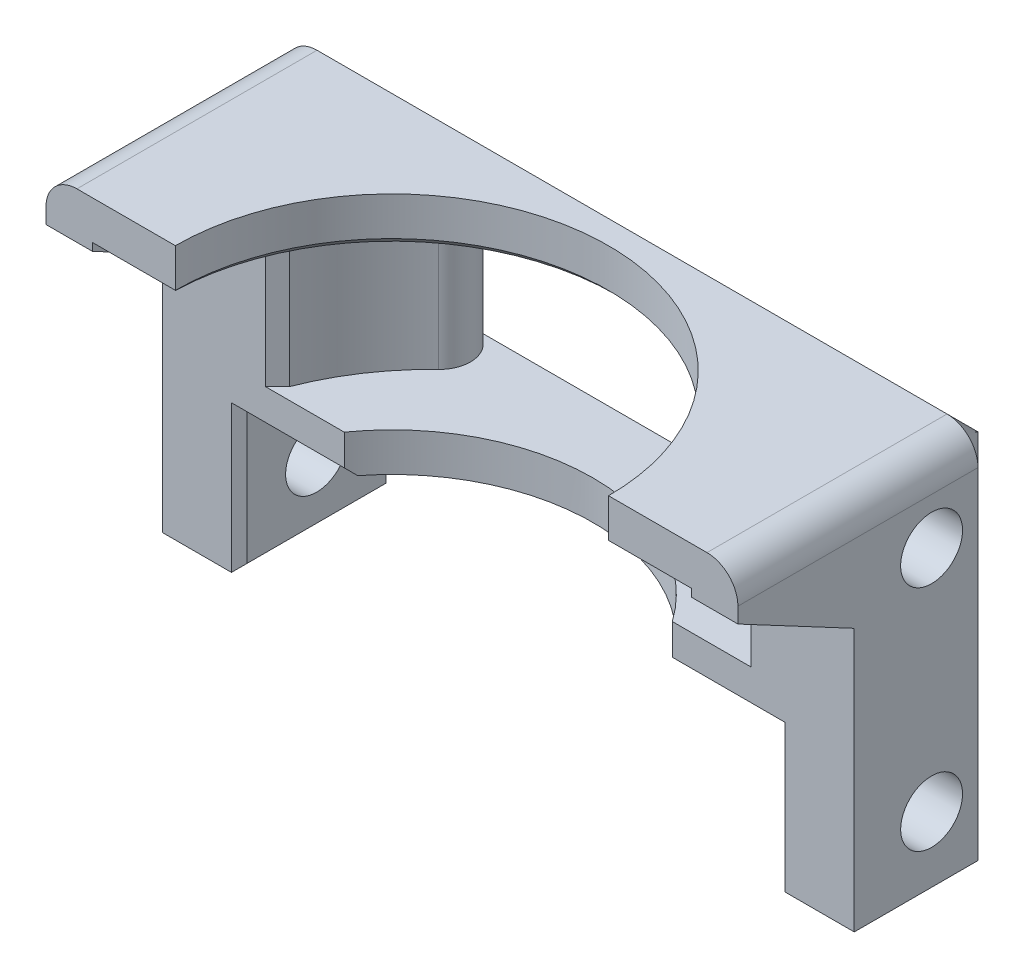
from build123d import *

# Parameters (mm, degrees)
EXTRUDE_1_DEPTH     = 10
SKETCH_2_W          = 16
SKETCH_2_H          = 9.5
EXTRUDE_2_DEPTH     = 17.52
CUT_EXTRUDE_1_DEPTH = 3
CUT_EXTRUDE_2_DEPTH = 2.5
EXTRUDE_3_DEPTH     = 3
EXTRUDE_4_DEPTH     = 3
FILLET_1_R          = 2
CHAMFER_1_SIZE      = 2
CUT_EXTRUDE_3_DEPTH = 6
CUT_EXTRUDE_4_REACH = 55.7
CHAMFER_2_SIZE      = 0.5
FILLET_2_R          = 2


# Some blends are built 0.0001 mm under size
with BuildPart() as part:
    # 草图1 → 凸台-拉伸1 (new body)
    with BuildSketch(Plane.XY):
        Polygon((0, 0), (4.97, 0), (4.97, 9), (39.75, 9), (39.75, 0), (44.73, 0), (44.73, 24), (0, 24), align=None)
    extrude(amount=EXTRUDE_1_DEPTH)

    # 草图2 → 切除-旋转2 (revolve, cut)
    with BuildSketch(Plane(origin=(0, 0, 15), x_dir=(-1, 0, 0), z_dir=(0, 0, -1))):
        with Locations((-14.365, 16.25)):
            Rectangle(SKETCH_2_W, SKETCH_2_H)
    revolve(axis=Axis((22.365, 28.168186047, 15), (0, -1, 0)), mode=Mode.SUBTRACT)

    # 草图4 → 凸台-拉伸2 (add)
    with BuildSketch(Plane(origin=(0, 0, 0), x_dir=(-1, 0, 0), z_dir=(0, 0, -1))):
        Polygon((-44.73, 24), (0, 24), (0, 21), (-7.166315846, 21), (-37.563684154, 21), (-44.73, 21), align=None)
    extrude(amount=-EXTRUDE_2_DEPTH)

    # 草图5 → 切除-拉伸1 (cut)
    with BuildSketch(Plane(origin=(0, 24, 0), x_dir=(1, 0, 0), z_dir=(0, 1, 0))):
        with BuildLine():
            Line((8.365, -17.52), (36.365, -17.52))
            ThreePointArc((36.365, -17.52), (22.365, -3.52), (8.365, -17.52))
        make_face()
    extrude(amount=-CUT_EXTRUDE_1_DEPTH, mode=Mode.SUBTRACT)

    # 草图6 → 切除-拉伸2 (cut)
    with BuildSketch(Plane(origin=(0, 11.5, 0), x_dir=(1, 0, 0), z_dir=(0, 1, 0))):
        with BuildLine():
            ThreePointArc((32.969225573, -10), (22.365, -4.52), (11.760774427, -10))
            Line((11.760774427, -10), (32.969225573, -10))
        make_face()
    extrude(amount=-CUT_EXTRUDE_2_DEPTH, mode=Mode.SUBTRACT)

    # 草图7 → 凸台-拉伸3 (add)
    with BuildSketch(Plane.ZY):
        Polygon((10, 17), (10, 21), (17.52, 21), align=None)
    extrude(amount=-EXTRUDE_3_DEPTH)

    # 草图8 → 凸台-拉伸4 (add)
    with BuildSketch(Plane(origin=(44.73, 0, 0), x_dir=(0, 0, -1), z_dir=(1, 0, 0))):
        Polygon((-17.52, 21), (-10, 17), (-10, 21), align=None)
    extrude(amount=-EXTRUDE_4_DEPTH)

    # 圆角1
    fillet_1_edges = [part.edges().sort_by_distance(p)[0] for p in [
        (0, 24, 8.76),
        (44.73, 24, 8.76),
    ]]
    fillet(fillet_1_edges, radius=FILLET_1_R)

    # 倒角1
    chamfer_1_edges = [part.edges().sort_by_distance(p)[0] for p in [
        (22.365, 24, 0),
        (0, 11, 0),
        (0.585786438, 23.414213562, 0),
        (44.144213562, 23.414213562, 0),
        (44.73, 11, 0),
    ]]
    chamfer(chamfer_1_edges, length=CHAMFER_1_SIZE - 0.0001)  # a hair under: the kernel refuses the full size

    # 草图9 → 切除-拉伸3 (cut)
    with BuildSketch(Plane(origin=(44.73, 0, 0), x_dir=(0, 0, -1), z_dir=(1, 0, 0))):
        with BuildLine():
            ThreePointArc((-6.414213562, 17.585786438), (-5, 17), (-3.585786438, 17.585786438))
            Line((-3.585786438, 17.585786438), (-5, 19))
            Line((-5, 19), (-6.414213562, 17.585786438))
        make_face()
        with BuildLine():
            Line((-5, 19), (-3.585786438, 17.585786438))
            ThreePointArc((-3.585786438, 17.585786438), (-3.152240935, 18.234633135), (-3, 19))
            ThreePointArc((-3, 19), (-3.152240935, 19.765366865), (-3.585786438, 20.414213562))
            Line((-3.585786438, 20.414213562), (-5, 19))
        make_face()
        with BuildLine():
            ThreePointArc((-6.414213562, 20.414213562), (-7, 19), (-6.414213562, 17.585786438))
            Line((-6.414213562, 17.585786438), (-5, 19))
            Line((-5, 19), (-6.414213562, 20.414213562))
        make_face()
        with BuildLine():
            Line((-6.414213562, 20.414213562), (-5, 19))
            Line((-5, 19), (-3.585786438, 20.414213562))
            ThreePointArc((-3.585786438, 20.414213562), (-5, 21), (-6.414213562, 20.414213562))
        make_face()
    cut_extrude_3 = extrude(amount=-CUT_EXTRUDE_3_DEPTH, mode=Mode.SUBTRACT)

    # 镜向1: 切除-拉伸3 across plane
    add(cut_extrude_3.mirror(Plane(origin=(22.365, 0, 0), x_dir=(0, 0, 1), z_dir=(1, 0, 0))), mode=Mode.SUBTRACT)

    # 切除-拉伸4: up to this face of the body (flat: up to its plane)
    cut_extrude_4_end = Plane(part.part.faces().sort_by_distance((44.73, 11.584828714, 6.907402267))[0])
    # 草图10 → 切除-拉伸4 (cut, up to the picked face)
    with BuildSketch(Plane.ZY, mode=Mode.PRIVATE) as cut_extrude_4_sk1:
        with BuildLine():
            ThreePointArc((3.474277506, 2.944620168), (5, 2.237744629), (6.525722494, 2.944620168))
            Line((6.525722494, 2.944620168), (5, 4.237744629))
            Line((5, 4.237744629), (3.474277506, 2.944620168))
        make_face()
    cut_extrude_4_tool1 = split(extrude(cut_extrude_4_sk1.sketch, amount=-CUT_EXTRUDE_4_REACH, mode=Mode.PRIVATE), bisect_by=cut_extrude_4_end, keep=Keep.BOTH, mode=Mode.PRIVATE)
    # 草图10 → 切除-拉伸4 (cut, up to the picked face)
    with BuildSketch(Plane.ZY, mode=Mode.PRIVATE) as cut_extrude_4_sk2:
        with BuildLine():
            Line((5, 4.237744629), (6.525722494, 2.944620168))
            ThreePointArc((6.525722494, 2.944620168), (6.877690734, 3.549066543), (7, 4.237744629))
            ThreePointArc((7, 4.237744629), (6.877690734, 4.926422715), (6.525722494, 5.53086909))
            Line((6.525722494, 5.53086909), (5, 4.237744629))
        make_face()
    cut_extrude_4_tool2 = split(extrude(cut_extrude_4_sk2.sketch, amount=-CUT_EXTRUDE_4_REACH, mode=Mode.PRIVATE), bisect_by=cut_extrude_4_end, keep=Keep.BOTH, mode=Mode.PRIVATE)
    # 草图10 → 切除-拉伸4 (cut, up to the picked face)
    with BuildSketch(Plane.ZY, mode=Mode.PRIVATE) as cut_extrude_4_sk3:
        with BuildLine():
            ThreePointArc((3.474277506, 5.53086909), (3, 4.237744629), (3.474277506, 2.944620168))
            Line((3.474277506, 2.944620168), (5, 4.237744629))
            Line((5, 4.237744629), (3.474277506, 5.53086909))
        make_face()
    cut_extrude_4_tool3 = split(extrude(cut_extrude_4_sk3.sketch, amount=-CUT_EXTRUDE_4_REACH, mode=Mode.PRIVATE), bisect_by=cut_extrude_4_end, keep=Keep.BOTH, mode=Mode.PRIVATE)
    # 草图10 → 切除-拉伸4 (cut, up to the picked face)
    with BuildSketch(Plane.ZY, mode=Mode.PRIVATE) as cut_extrude_4_sk4:
        with BuildLine():
            Line((5, 4.237744629), (6.525722494, 5.53086909))
            ThreePointArc((6.525722494, 5.53086909), (5, 6.237744629), (3.474277506, 5.53086909))
            Line((3.474277506, 5.53086909), (5, 4.237744629))
        make_face()
    cut_extrude_4_tool4 = split(extrude(cut_extrude_4_sk4.sketch, amount=-CUT_EXTRUDE_4_REACH, mode=Mode.PRIVATE), bisect_by=cut_extrude_4_end, keep=Keep.BOTH, mode=Mode.PRIVATE)
    # 草图10 → 切除-拉伸4 (cut, up to the picked face)
    with BuildSketch(Plane.ZY, mode=Mode.PRIVATE) as cut_extrude_4_sk5:
        with BuildLine():
            ThreePointArc((3.474277506, 2.944620168), (5, 2.237744629), (6.525722494, 2.944620168))
            Line((6.525722494, 2.944620168), (5, 4.237744629))
            Line((5, 4.237744629), (3.474277506, 2.944620168))
        make_face()
    cut_extrude_4_tool5 = split(extrude(cut_extrude_4_sk5.sketch, amount=-CUT_EXTRUDE_4_REACH, mode=Mode.PRIVATE), bisect_by=cut_extrude_4_end, keep=Keep.BOTH, mode=Mode.PRIVATE)
    # 草图10 → 切除-拉伸4 (cut, up to the picked face)
    with BuildSketch(Plane.ZY, mode=Mode.PRIVATE) as cut_extrude_4_sk6:
        with BuildLine():
            Line((5, 4.237744629), (6.525722494, 2.944620168))
            ThreePointArc((6.525722494, 2.944620168), (6.877690734, 3.549066543), (7, 4.237744629))
            ThreePointArc((7, 4.237744629), (6.877690734, 4.926422715), (6.525722494, 5.53086909))
            Line((6.525722494, 5.53086909), (5, 4.237744629))
        make_face()
    cut_extrude_4_tool6 = split(extrude(cut_extrude_4_sk6.sketch, amount=-CUT_EXTRUDE_4_REACH, mode=Mode.PRIVATE), bisect_by=cut_extrude_4_end, keep=Keep.BOTH, mode=Mode.PRIVATE)
    # 草图10 → 切除-拉伸4 (cut, up to the picked face)
    with BuildSketch(Plane.ZY, mode=Mode.PRIVATE) as cut_extrude_4_sk7:
        with BuildLine():
            ThreePointArc((3.474277506, 5.53086909), (3, 4.237744629), (3.474277506, 2.944620168))
            Line((3.474277506, 2.944620168), (5, 4.237744629))
            Line((5, 4.237744629), (3.474277506, 5.53086909))
        make_face()
    cut_extrude_4_tool7 = split(extrude(cut_extrude_4_sk7.sketch, amount=-CUT_EXTRUDE_4_REACH, mode=Mode.PRIVATE), bisect_by=cut_extrude_4_end, keep=Keep.BOTH, mode=Mode.PRIVATE)
    # 草图10 → 切除-拉伸4 (cut, up to the picked face)
    with BuildSketch(Plane.ZY, mode=Mode.PRIVATE) as cut_extrude_4_sk8:
        with BuildLine():
            Line((5, 4.237744629), (6.525722494, 5.53086909))
            ThreePointArc((6.525722494, 5.53086909), (5, 6.237744629), (3.474277506, 5.53086909))
            Line((3.474277506, 5.53086909), (5, 4.237744629))
        make_face()
    cut_extrude_4_tool8 = split(extrude(cut_extrude_4_sk8.sketch, amount=-CUT_EXTRUDE_4_REACH, mode=Mode.PRIVATE), bisect_by=cut_extrude_4_end, keep=Keep.BOTH, mode=Mode.PRIVATE)
    # 草图10 → 切除-拉伸4 (cut, up to the picked face)
    with BuildSketch(Plane.ZY, mode=Mode.PRIVATE) as cut_extrude_4_sk9:
        with BuildLine():
            ThreePointArc((3.474277506, 2.944620168), (5, 2.237744629), (6.525722494, 2.944620168))
            Line((6.525722494, 2.944620168), (5, 4.237744629))
            Line((5, 4.237744629), (3.474277506, 2.944620168))
        make_face()
    cut_extrude_4_tool9 = split(extrude(cut_extrude_4_sk9.sketch, amount=-CUT_EXTRUDE_4_REACH, mode=Mode.PRIVATE), bisect_by=cut_extrude_4_end, keep=Keep.BOTH, mode=Mode.PRIVATE)
    # 草图10 → 切除-拉伸4 (cut, up to the picked face)
    with BuildSketch(Plane.ZY, mode=Mode.PRIVATE) as cut_extrude_4_sk10:
        with BuildLine():
            Line((5, 4.237744629), (6.525722494, 2.944620168))
            ThreePointArc((6.525722494, 2.944620168), (6.877690734, 3.549066543), (7, 4.237744629))
            ThreePointArc((7, 4.237744629), (6.877690734, 4.926422715), (6.525722494, 5.53086909))
            Line((6.525722494, 5.53086909), (5, 4.237744629))
        make_face()
    cut_extrude_4_tool10 = split(extrude(cut_extrude_4_sk10.sketch, amount=-CUT_EXTRUDE_4_REACH, mode=Mode.PRIVATE), bisect_by=cut_extrude_4_end, keep=Keep.BOTH, mode=Mode.PRIVATE)
    # 草图10 → 切除-拉伸4 (cut, up to the picked face)
    with BuildSketch(Plane.ZY, mode=Mode.PRIVATE) as cut_extrude_4_sk11:
        with BuildLine():
            ThreePointArc((3.474277506, 5.53086909), (3, 4.237744629), (3.474277506, 2.944620168))
            Line((3.474277506, 2.944620168), (5, 4.237744629))
            Line((5, 4.237744629), (3.474277506, 5.53086909))
        make_face()
    cut_extrude_4_tool11 = split(extrude(cut_extrude_4_sk11.sketch, amount=-CUT_EXTRUDE_4_REACH, mode=Mode.PRIVATE), bisect_by=cut_extrude_4_end, keep=Keep.BOTH, mode=Mode.PRIVATE)
    # 草图10 → 切除-拉伸4 (cut, up to the picked face)
    with BuildSketch(Plane.ZY, mode=Mode.PRIVATE) as cut_extrude_4_sk12:
        with BuildLine():
            Line((5, 4.237744629), (6.525722494, 5.53086909))
            ThreePointArc((6.525722494, 5.53086909), (5, 6.237744629), (3.474277506, 5.53086909))
            Line((3.474277506, 5.53086909), (5, 4.237744629))
        make_face()
    cut_extrude_4_tool12 = split(extrude(cut_extrude_4_sk12.sketch, amount=-CUT_EXTRUDE_4_REACH, mode=Mode.PRIVATE), bisect_by=cut_extrude_4_end, keep=Keep.BOTH, mode=Mode.PRIVATE)
    # 草图10 → 切除-拉伸4 (cut, up to the picked face)
    with BuildSketch(Plane.ZY, mode=Mode.PRIVATE) as cut_extrude_4_sk13:
        with BuildLine():
            ThreePointArc((3.474277506, 2.944620168), (5, 2.237744629), (6.525722494, 2.944620168))
            Line((6.525722494, 2.944620168), (5, 4.237744629))
            Line((5, 4.237744629), (3.474277506, 2.944620168))
        make_face()
    cut_extrude_4_tool13 = split(extrude(cut_extrude_4_sk13.sketch, amount=-CUT_EXTRUDE_4_REACH, mode=Mode.PRIVATE), bisect_by=cut_extrude_4_end, keep=Keep.BOTH, mode=Mode.PRIVATE)
    # 草图10 → 切除-拉伸4 (cut, up to the picked face)
    with BuildSketch(Plane.ZY, mode=Mode.PRIVATE) as cut_extrude_4_sk14:
        with BuildLine():
            Line((5, 4.237744629), (6.525722494, 2.944620168))
            ThreePointArc((6.525722494, 2.944620168), (6.877690734, 3.549066543), (7, 4.237744629))
            ThreePointArc((7, 4.237744629), (6.877690734, 4.926422715), (6.525722494, 5.53086909))
            Line((6.525722494, 5.53086909), (5, 4.237744629))
        make_face()
    cut_extrude_4_tool14 = split(extrude(cut_extrude_4_sk14.sketch, amount=-CUT_EXTRUDE_4_REACH, mode=Mode.PRIVATE), bisect_by=cut_extrude_4_end, keep=Keep.BOTH, mode=Mode.PRIVATE)
    # 草图10 → 切除-拉伸4 (cut, up to the picked face)
    with BuildSketch(Plane.ZY, mode=Mode.PRIVATE) as cut_extrude_4_sk15:
        with BuildLine():
            ThreePointArc((3.474277506, 5.53086909), (3, 4.237744629), (3.474277506, 2.944620168))
            Line((3.474277506, 2.944620168), (5, 4.237744629))
            Line((5, 4.237744629), (3.474277506, 5.53086909))
        make_face()
    cut_extrude_4_tool15 = split(extrude(cut_extrude_4_sk15.sketch, amount=-CUT_EXTRUDE_4_REACH, mode=Mode.PRIVATE), bisect_by=cut_extrude_4_end, keep=Keep.BOTH, mode=Mode.PRIVATE)
    # 草图10 → 切除-拉伸4 (cut, up to the picked face)
    with BuildSketch(Plane.ZY, mode=Mode.PRIVATE) as cut_extrude_4_sk16:
        with BuildLine():
            Line((5, 4.237744629), (6.525722494, 5.53086909))
            ThreePointArc((6.525722494, 5.53086909), (5, 6.237744629), (3.474277506, 5.53086909))
            Line((3.474277506, 5.53086909), (5, 4.237744629))
        make_face()
    cut_extrude_4_tool16 = split(extrude(cut_extrude_4_sk16.sketch, amount=-CUT_EXTRUDE_4_REACH, mode=Mode.PRIVATE), bisect_by=cut_extrude_4_end, keep=Keep.BOTH, mode=Mode.PRIVATE)
    add(cut_extrude_4_tool1.solids().sort_by(Axis((0, 3.065546, 5), (1, 0, 0)))[0], mode=Mode.SUBTRACT)
    add(cut_extrude_4_tool2.solids().sort_by(Axis((0, 4.237745, 6.226171), (1, 0, 0)))[0], mode=Mode.SUBTRACT)
    add(cut_extrude_4_tool3.solids().sort_by(Axis((0, 4.237745, 3.773829), (1, 0, 0)))[0], mode=Mode.SUBTRACT)
    add(cut_extrude_4_tool4.solids().sort_by(Axis((0, 5.409943, 5), (1, 0, 0)))[0], mode=Mode.SUBTRACT)
    add(cut_extrude_4_tool5.solids().sort_by(Axis((0, 3.065546, 5), (1, 0, 0)))[0], mode=Mode.SUBTRACT)
    add(cut_extrude_4_tool6.solids().sort_by(Axis((0, 4.237745, 6.226171), (1, 0, 0)))[0], mode=Mode.SUBTRACT)
    add(cut_extrude_4_tool7.solids().sort_by(Axis((0, 4.237745, 3.773829), (1, 0, 0)))[0], mode=Mode.SUBTRACT)
    add(cut_extrude_4_tool8.solids().sort_by(Axis((0, 5.409943, 5), (1, 0, 0)))[0], mode=Mode.SUBTRACT)
    add(cut_extrude_4_tool9.solids().sort_by(Axis((0, 3.065546, 5), (1, 0, 0)))[0], mode=Mode.SUBTRACT)
    add(cut_extrude_4_tool10.solids().sort_by(Axis((0, 4.237745, 6.226171), (1, 0, 0)))[0], mode=Mode.SUBTRACT)
    add(cut_extrude_4_tool11.solids().sort_by(Axis((0, 4.237745, 3.773829), (1, 0, 0)))[0], mode=Mode.SUBTRACT)
    add(cut_extrude_4_tool12.solids().sort_by(Axis((0, 5.409943, 5), (1, 0, 0)))[0], mode=Mode.SUBTRACT)
    add(cut_extrude_4_tool13.solids().sort_by(Axis((0, 3.065546, 5), (1, 0, 0)))[0], mode=Mode.SUBTRACT)
    add(cut_extrude_4_tool14.solids().sort_by(Axis((0, 4.237745, 6.226171), (1, 0, 0)))[0], mode=Mode.SUBTRACT)
    add(cut_extrude_4_tool15.solids().sort_by(Axis((0, 4.237745, 3.773829), (1, 0, 0)))[0], mode=Mode.SUBTRACT)
    add(cut_extrude_4_tool16.solids().sort_by(Axis((0, 5.409943, 5), (1, 0, 0)))[0], mode=Mode.SUBTRACT)

    # 倒角2
    # the kernel refuses this chamfer: 0.784414919, 0.5 mm, written as the material it takes off along each edge
    with BuildSketch(Plane(origin=(41.73, 21, 17.52), x_dir=(0, 0, -1), z_dir=(-1, 0, 0))) as chamfer_2_piece_1:
        Polygon((CHAMFER_2_SIZE, 0), (0, -CHAMFER_2_SIZE), (0, 0), align=None)
    extrude(amount=6.650841494, mode=Mode.SUBTRACT)
    with BuildSketch(Plane(origin=(4.97, -1.285841494, 0), x_dir=(-1, 0, 0), z_dir=(0, 1, 0)), Plane(origin=(39.75, 9, 10), x_dir=(0, 0, -1), z_dir=(0, -1, 0)), Plane(origin=(39.75, 9, 0), x_dir=(1, 0, 0), z_dir=(0, -1, 0))) as chamfer_2_piece_2:
        Polygon((CHAMFER_2_SIZE, 0), (0, CHAMFER_2_SIZE), (0, 0), align=None)
    extrude(amount=10.285841494, mode=Mode.SUBTRACT)
    with BuildSketch(Plane(origin=(4.97, -1.285841494, 10), x_dir=(-1, 0, 0), z_dir=(0, 1, 0))) as chamfer_2_piece_3:
        Polygon((CHAMFER_2_SIZE, 0), (0, -CHAMFER_2_SIZE), (0, 0), align=None)
    extrude(amount=10.285841494, mode=Mode.SUBTRACT)
    with BuildSketch(Plane(origin=(39.75, 0, -1.285841494), x_dir=(1, 0, 0), z_dir=(0, 0, 1))) as chamfer_2_piece_4:
        Polygon((CHAMFER_2_SIZE, 0), (0, CHAMFER_2_SIZE), (0, 0), align=None)
    extrude(amount=12.571682988, mode=Mode.SUBTRACT)
    with BuildSketch(Plane(origin=(4.97, 0, -1.285841494), x_dir=(-1, 0, 0), z_dir=(0, 0, 1))) as chamfer_2_piece_5:
        Polygon((CHAMFER_2_SIZE, 0), (0, -CHAMFER_2_SIZE), (0, 0), align=None)
    extrude(amount=12.571682988, mode=Mode.SUBTRACT)
    with BuildSketch(Plane(origin=(4.97, 9, 10), x_dir=(0, 1, 0), z_dir=(1, 0, 0))) as chamfer_2_piece_6:
        Polygon((CHAMFER_2_SIZE, 0), (0, -CHAMFER_2_SIZE), (0, 0), align=None)
    extrude(amount=8.076615921, mode=Mode.SUBTRACT)
    with BuildSketch(Plane(origin=(9.650841494, 21, 17.52), x_dir=(0, 1, 0), z_dir=(-1, 0, 0))) as chamfer_2_piece_7:
        Polygon((CHAMFER_2_SIZE, 0), (0, CHAMFER_2_SIZE), (0, 0), align=None)
    extrude(amount=6.650841494, mode=Mode.SUBTRACT)
    with BuildSketch(Plane(origin=(22.365, 21, 17.52), x_dir=(0.9957715788349903, 0, 0.09186382739942131), z_dir=(-0.09186382739942131, 0, 0.9957715788349903))) as chamfer_2_piece_8:
        Polygon((14 + CHAMFER_2_SIZE, 0), (14, CHAMFER_2_SIZE), (14, 0), align=None)
    revolve(axis=Axis((22.365, 21, 17.52), (0, 1, 0)), revolution_arc=190.541681616, mode=Mode.SUBTRACT)
    with BuildSketch(Plane(origin=(31.683384079, 9, 10), x_dir=(0, 0, -1), z_dir=(1, 0, 0))) as chamfer_2_piece_9:
        Polygon((CHAMFER_2_SIZE, 0), (0, CHAMFER_2_SIZE), (0, 0), align=None)
    extrude(amount=8.066615921, mode=Mode.SUBTRACT)
    with BuildSketch(Plane(origin=(37.563684154, 21, 10), x_dir=(-0.3369457278285583, 0, -0.941524071119843), z_dir=(0, -1, 0))) as chamfer_2_piece_10:
        with BuildLine():
            Line((0.827022677, 0), (-CHAMFER_2_SIZE * 0.336945727829, CHAMFER_2_SIZE * 0.94152407112))
            Line((-CHAMFER_2_SIZE * 0.336945727829, CHAMFER_2_SIZE * 0.94152407112), (0, 0))
            ThreePointArc((0, 0), (0.427704475, 0.005338086), (0.827022677, 0))
        make_face()
    extrude(amount=9.5, mode=Mode.SUBTRACT)
    with BuildSketch(Plane(origin=(7.166315846, 21, 10), x_dir=(-1, 0, 0), z_dir=(0, -1, 0))) as chamfer_2_piece_11:
        with BuildLine():
            Line((CHAMFER_2_SIZE, 0), (-0.278661758, 0.778661758))
            ThreePointArc((-0.278661758, 0.778661758), (-0.139087259, 0.404492704), (0, 0))
            Line((0, 0), (CHAMFER_2_SIZE, 0))
        make_face()
    extrude(amount=9.5, mode=Mode.SUBTRACT)
    with BuildSketch(Plane(origin=(3.684158506, 9, 10), x_dir=(0, 1, 0), z_dir=(1, 0, 0))) as chamfer_2_piece_12a_section:
        Polygon((CHAMFER_2_SIZE, 0), (0, -CHAMFER_2_SIZE), (0, 0), align=None)
    chamfer_2_piece_12a = extrude(amount=9.362457415, mode=Mode.PRIVATE)
    chamfer_2_piece_12a = split(chamfer_2_piece_12a, bisect_by=Plane(origin=(4.97, 9, 10), z_dir=(-1, 0, 0)), keep=Keep.TOP, mode=Mode.PRIVATE)
    with BuildSketch(Plane(origin=(4.97, 0, 10), x_dir=(-1, 0, 0), z_dir=(0, 1, 0))) as chamfer_2_piece_12b_section:
        Polygon((CHAMFER_2_SIZE, 0), (0, -CHAMFER_2_SIZE), (0, 0), align=None)
    chamfer_2_piece_12b = extrude(amount=10.285841494, mode=Mode.PRIVATE)
    chamfer_2_piece_12b = split(chamfer_2_piece_12b, bisect_by=Plane(origin=(4.97, 9, 10), z_dir=(0, 1, 0)), keep=Keep.TOP, mode=Mode.PRIVATE)
    chamfer_2_piece_12 = chamfer_2_piece_12a & chamfer_2_piece_12b
    add(chamfer_2_piece_12, mode=Mode.SUBTRACT)
    with BuildSketch(Plane(origin=(31.683384079, 9, 10), x_dir=(0, 0, -1), z_dir=(1, 0, 0))) as chamfer_2_piece_13a_section:
        Polygon((CHAMFER_2_SIZE, 0), (0, CHAMFER_2_SIZE), (0, 0), align=None)
    chamfer_2_piece_13a = extrude(amount=9.352457415, mode=Mode.PRIVATE)
    chamfer_2_piece_13a = split(chamfer_2_piece_13a, bisect_by=Plane(origin=(39.75, 9, 10), z_dir=(1, 0, 0)), keep=Keep.TOP, mode=Mode.PRIVATE)
    with BuildSketch(Plane(origin=(39.75, 10.285841494, 10), x_dir=(0, 0, -1), z_dir=(0, -1, 0))) as chamfer_2_piece_13b_section:
        Polygon((CHAMFER_2_SIZE, 0), (0, CHAMFER_2_SIZE), (0, 0), align=None)
    chamfer_2_piece_13b = extrude(amount=10.285841494, mode=Mode.PRIVATE)
    chamfer_2_piece_13b = split(chamfer_2_piece_13b, bisect_by=Plane(origin=(39.75, 9, 10), z_dir=(0, 1, 0)), keep=Keep.TOP, mode=Mode.PRIVATE)
    chamfer_2_piece_13 = chamfer_2_piece_13a & chamfer_2_piece_13b
    add(chamfer_2_piece_13, mode=Mode.SUBTRACT)

    # 圆角2
    fillet_2_edges = [part.edges().sort_by_distance(p)[0] for p in [
        (16.797235637, 16.25, 0),
        (27.932764363, 16.25, 0),
    ]]
    fillet(fillet_2_edges, radius=FILLET_2_R)


solid = part.part
